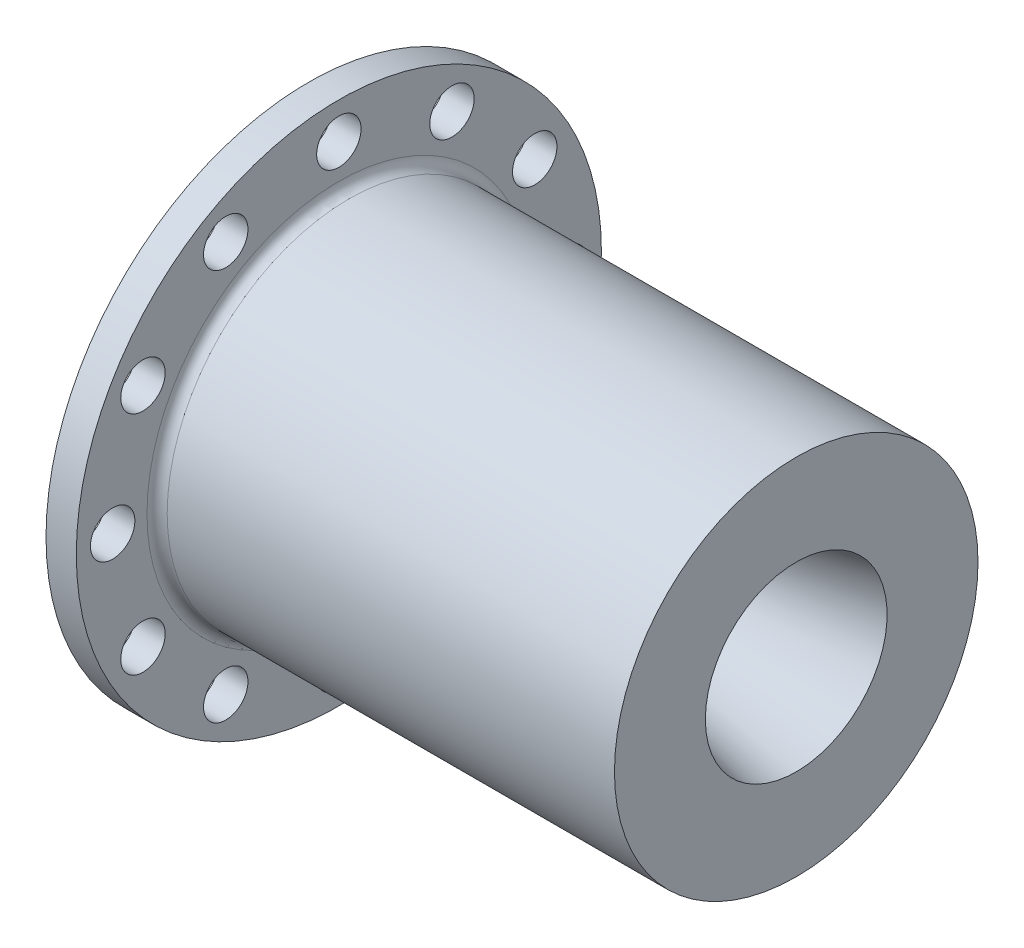
from build123d import *

# Parameters (mm, degrees)
FILLET1_R          = 1.27
CUT_EXTRUDE1_REACH = 79.086
SKETCH2_R          = 2.794
CIRPATTERN1_COUNT  = 12


with BuildPart() as part:
    # Chamber Revolve → Revolve1 (revolve)
    with BuildSketch(Plane.XY):
        Polygon((3.81, 22.86), (61.331753256, 22.86), (61.331753256, 11.43), (43.197991731, 7.57555), (41.673991731, 7.57555), (38.1, 15.24), (0, 15.24), (0, 18.415), (1.016, 18.415), (1.016, 20.955), (0, 20.955), (0, 33.02), (3.81, 33.02), align=None)
    revolve(axis=Axis((0, 0, 0), (1, 0, 0)))

    # Fillet1
    fillet1_edges = [part.edges().sort_by_distance(p)[0] for p in [
        (3.81, -22.86, 0),
    ]]
    fillet(fillet1_edges, radius=FILLET1_R)

    # Sketch2 → Cut-Extrude1 (cut, up to next)
    with BuildSketch(Plane.ZY, mode=Mode.PRIVATE) as cut_extrude1_sk1:
        with Locations((0, 28.448)):
            Circle(SKETCH2_R)
    cut_extrude1_tool1 = extrude(cut_extrude1_sk1.sketch, amount=-CUT_EXTRUDE1_REACH, mode=Mode.PRIVATE) & part.part
    cut_extrude1 = cut_extrude1_tool1.solids().sort_by_distance((0, 28.448, 0))[0]
    add(cut_extrude1, mode=Mode.SUBTRACT)

    # CirPattern1: Cut-Extrude1 ×12 about axis
    cirpattern1_axis = Axis((0, 0, 0), (-1, 0, 0))
    for i in range(1, CIRPATTERN1_COUNT):
        add(cut_extrude1.rotate(cirpattern1_axis, i * 360 / CIRPATTERN1_COUNT), mode=Mode.SUBTRACT)


solid = part.part
